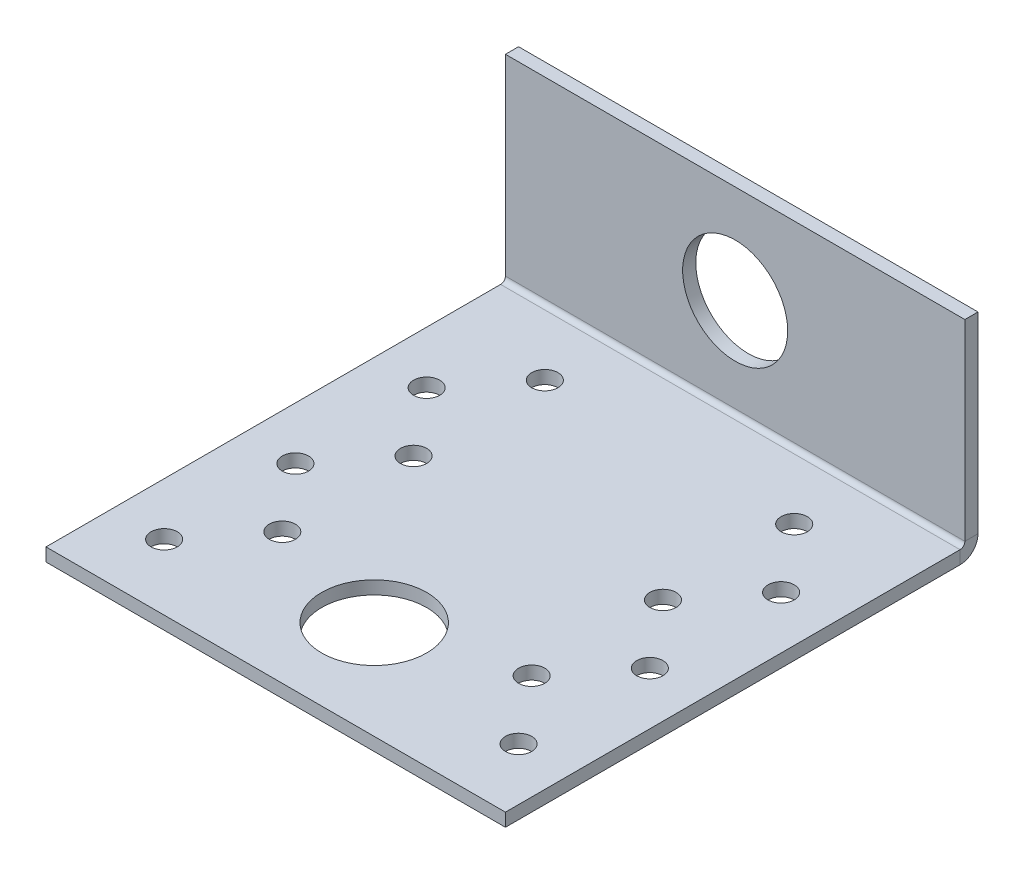
from build123d import *

# Parameters (mm, degrees)
SKETCH1_W                    = 70
SKETCH1_H                    = 70
BASE_FLANGE1_DEPTH           = 2
EDGE_FLANGE1_STRIP_W         = 9.4732
EDGE_FLANGE1_STRIP_H         = 2
EDGE_FLANGE1_STRIP_CUT_DEPTH = 70
EDGE_FLANGE1_DEPTH           = 70
SKETCH9_R                    = 8
CUT_EXTRUDE1_DEPTH           = 10
SKETCH11_R                   = 8
SKETCH11_R_2                 = 2
CUT_EXTRUDE2_DEPTH           = 10


# Sheet-metal steps are written as plain solids
with BuildPart() as part:
    # Sketch1 → Base-Flange1 (new body)
    with BuildSketch(Plane(origin=(0, 0, 0), x_dir=(1, 0, 0), z_dir=(0, 1, 0))):
        Rectangle(SKETCH1_W, SKETCH1_H)
    extrude(amount=-BASE_FLANGE1_DEPTH)

    # Edge-Flange1 strip (across the edge) → Edge-Flange1 strip cut (cut)
    with BuildSketch(Plane(origin=(35, 0, -35), x_dir=(0, 0, 1), z_dir=(-1, 0, 0))):
        with Locations((-4, -1)):
            Rectangle(EDGE_FLANGE1_STRIP_W, EDGE_FLANGE1_STRIP_H)
    extrude(amount=EDGE_FLANGE1_STRIP_CUT_DEPTH, mode=Mode.SUBTRACT)

    # Edge-Flange1 section (across the edge) → Edge-Flange1 (add)
    with BuildSketch(Plane(origin=(35, 0, -35), x_dir=(0, 0, 1), z_dir=(-1, 0, 0))):
        with BuildLine():
            Line((-2, 0.7366), (-2, 30))
            Line((-2, 30), (0, 30))
            Line((0, 30), (0, 0.7366))
            ThreePointArc((0, 0.7366), (0.215745145, 0.215745145), (0.7366, 0))
            Line((0.7366, 0), (0.7366, -2))
            ThreePointArc((0.7366, -2), (-1.198468417, -1.198468417), (-2, 0.7366))
        make_face()
    extrude(amount=EDGE_FLANGE1_DEPTH)

    # Sketch9 → Cut-Extrude1 (cut)
    with BuildSketch(Plane.XY.offset(-35)):
        with Locations((0, 15)):
            Circle(SKETCH9_R)
    extrude(amount=-CUT_EXTRUDE1_DEPTH, mode=Mode.SUBTRACT)

    # Sketch11 → Cut-Extrude2 (cut)
    with BuildSketch(Plane.XZ.offset(2)):
        with Locations(Location((0, 20, 0), (0, 0, 270))):
            Circle(SKETCH11_R)
        with Locations(Location((-27, 25, 0), (0, 0, 270))):
            Circle(SKETCH11_R_2)
        with Locations(Location((-19, 15, 0), (0, 0, 270))):
            Circle(SKETCH11_R_2)
        with Locations(Location((-27, 5, 0), (0, 0, 270))):
            Circle(SKETCH11_R_2)
        with Locations(Location((-19, -5, 0), (0, 0, 270))):
            Circle(SKETCH11_R_2)
        with Locations(Location((-27, -15, 0), (0, 0, 270))):
            Circle(SKETCH11_R_2)
        with Locations(Location((-19, -25, 0), (0, 0, 270))):
            Circle(SKETCH11_R_2)
        with Locations(Location((27, 5, 0), (0, 0, 90))):
            Circle(SKETCH11_R_2)
        with Locations(Location((19, 15, 0), (0, 0, 90))):
            Circle(SKETCH11_R_2)
        with Locations(Location((19, -25, 0), (0, 0, 90))):
            Circle(SKETCH11_R_2)
        with Locations(Location((27, -15, 0), (0, 0, 90))):
            Circle(SKETCH11_R_2)
        with Locations(Location((19, -5, 0), (0, 0, 90))):
            Circle(SKETCH11_R_2)
        with Locations(Location((27, 25, 0), (0, 0, 90))):
            Circle(SKETCH11_R_2)
    extrude(amount=-CUT_EXTRUDE2_DEPTH, mode=Mode.SUBTRACT)


solid = part.part
